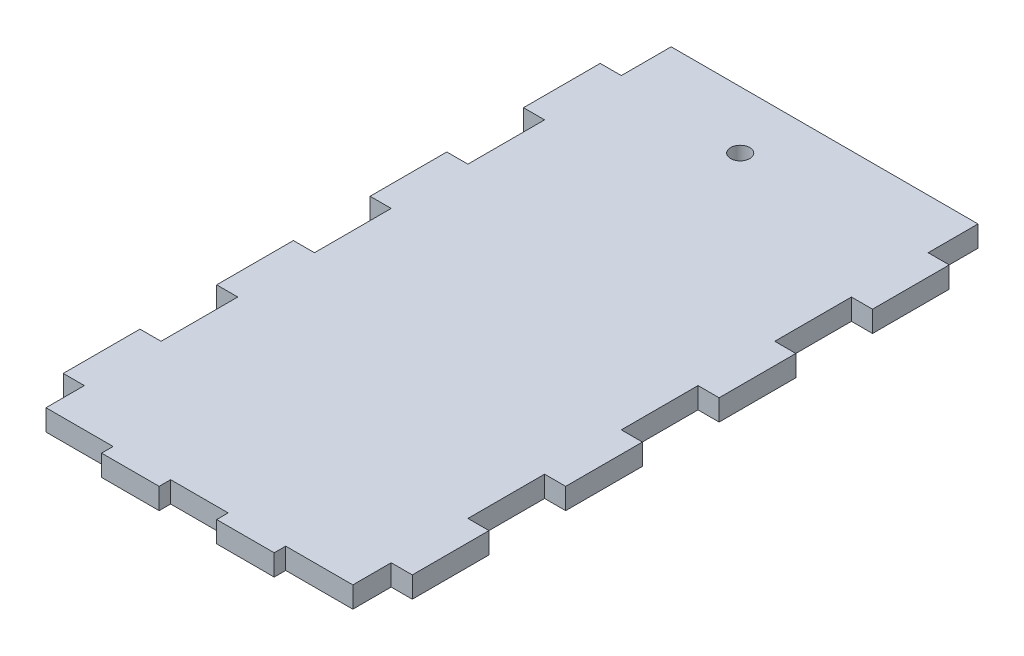
from build123d import *

# Parameters (mm, degrees)
CROQUIS1_R              = 2.5
SALIENTE_EXTRUIR1_DEPTH = 5.5


with BuildPart() as part:
    # Croquis1 → Saliente-Extruir1 (new body)
    with BuildSketch(Plane(origin=(0, 0, 0), x_dir=(1, 0, 0), z_dir=(0, 1, 0))):
        Polygon((23, 3), (23, 0), (38, 0), (38, 3), (53, 3), (53, 0), (68, 0), (68, 3), (85.5, 3), (85.5, 13), (91, 13), (91, 33), (85.5, 33), (85.5, 53), (91, 53), (91, 73), (85.5, 73), (85.5, 93), (91, 93), (91, 113), (85.5, 113), (85.5, 133), (91, 133), (91, 153), (85.5, 153), (85.5, 166), (5.5, 166), (5.5, 153), (0, 153), (0, 133), (5.5, 133), (5.5, 113), (0, 113), (0, 93), (5.5, 93), (5.5, 73), (0, 73), (0, 53), (5.5, 53), (5.5, 33), (0, 33), (0, 13), (5.5, 13), (5.5, 3), align=None)
        with Locations((38.5, 151)):
            Circle(CROQUIS1_R, mode=Mode.SUBTRACT)
    extrude(amount=SALIENTE_EXTRUIR1_DEPTH)


solid = part.part
